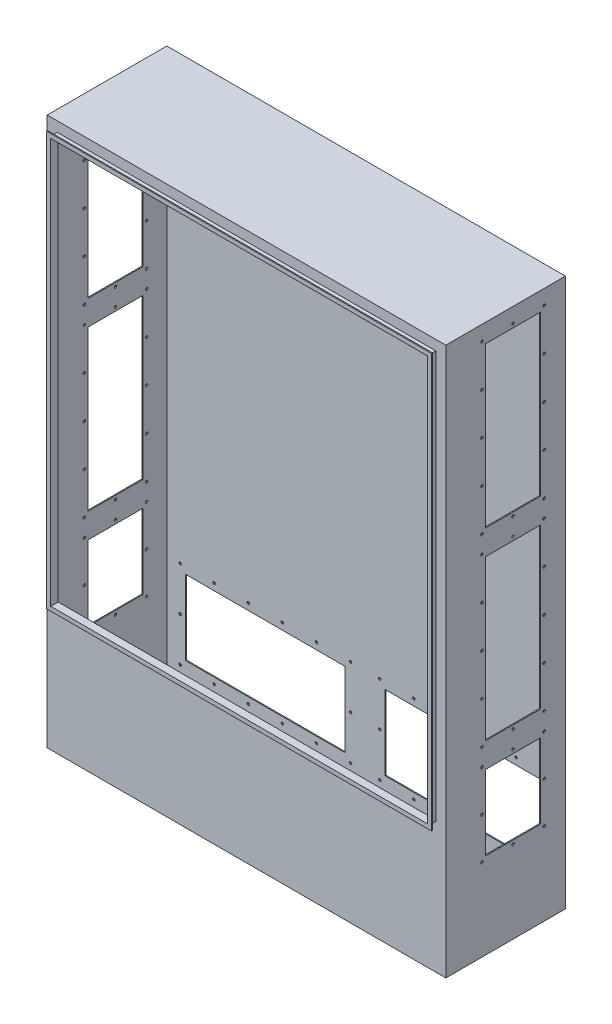
from build123d import *

# Parameters (mm, degrees)
SKETCH1_W               = 1016
SKETCH1_H               = 1397
MAIN_PANEL_DEPTH        = 2.54
SKETCH2_W               = 1016
SKETCH2_H               = 1397
SKETCH2_W_2             = 1010.92
SKETCH2_H_2             = 1391.92
WALLS_DEPTH             = 302.26
SIDE_CUTS_DEPTH         = 1271.063498413
SIDE_CUTS_DEPTH_BACK    = 1271.063498413
SKETCH3_W               = 139.7
SKETCH3_H               = 406.4
SKETCH3_H_2             = 190.5
CAM_HOLES_REACH         = 917.898
SKETCH4_W               = 406.4
SKETCH4_H               = 190.5
SKETCH4_R               = 3.175
BOTTOM_TRAP_DOOR_REACH  = 1517.086
SKETCH5_W               = 609.6
SKETCH5_H               = 101.6
SKETCH6_W               = 1016
SKETCH6_H               = 1397
SKETCH6_W_2             = 965.2
SKETCH6_H_2             = 1038.225
FRONT_FACE_DEPTH        = 2.54
SKETCH7_W               = 965.2
SKETCH7_H               = 1038.225
SKETCH7_W_2             = 960.12
SKETCH7_H_2             = 1033.145
BOSS_EXTRUDE1_DEPTH     = 19.05
SKETCH8_W               = 981.2
SKETCH8_H               = 1054.225
SKETCH8_W_2             = 965.2
SKETCH8_H_2             = 1038.225
BOSS_EXTRUDE2_DEPTH     = 2.54
CUT_EXTRUDE1_DEPTH      = 1364.402820153
CUT_EXTRUDE1_DEPTH_BACK = 1364.402820153
F_3DSKETCH1_R           = 3.175


with BuildPart() as part:
    # Sketch1 → Main Panel (new body)
    with BuildSketch(Plane.XY):
        Rectangle(SKETCH1_W, SKETCH1_H)
    extrude(amount=MAIN_PANEL_DEPTH)

    # Sketch2 → Walls (add)
    with BuildSketch(Plane.XY.offset(2.54)):
        Rectangle(SKETCH2_W, SKETCH2_H)
        Rectangle(SKETCH2_W_2, SKETCH2_H_2, mode=Mode.SUBTRACT)
    extrude(amount=WALLS_DEPTH)

    # Sketch3 → Side Cuts (cut, two sides: drawn at the far end of the back side and taken through both)
    with BuildSketch(Plane(origin=(508, 0, 0), x_dir=(0, 0, -1), z_dir=(1, 0, 0)).offset(-SIDE_CUTS_DEPTH_BACK)):
        with Locations((-133.35, 447.675)):
            Rectangle(SKETCH3_W, SKETCH3_H)
        with Locations((-133.35, -22.225)):
            Rectangle(SKETCH3_W, SKETCH3_H)
        with Locations((-133.35, -384.175)):
            Rectangle(SKETCH3_W, SKETCH3_H_2)
    extrude(amount=SIDE_CUTS_DEPTH + SIDE_CUTS_DEPTH_BACK, mode=Mode.SUBTRACT)

    # Sketch4 → Cam Holes (cut, up to next)
    with BuildSketch(Plane(origin=(0, 0, 0), x_dir=(-1, 0, 0), z_dir=(0, 0, -1)), mode=Mode.PRIVATE) as cam_holes_sk1:
        with Locations((-254.4, -536.575)):
            Rectangle(SKETCH4_W, SKETCH4_H)
    cam_holes_tool1 = extrude(cam_holes_sk1.sketch, amount=-CAM_HOLES_REACH, mode=Mode.PRIVATE) & part.part
    # Sketch4 → Cam Holes (cut, up to next)
    with BuildSketch(Plane(origin=(0, 0, 0), x_dir=(-1, 0, 0), z_dir=(0, 0, -1)), mode=Mode.PRIVATE) as cam_holes_sk2:
        with Locations((-37.23, -536.078621574)):
            Circle(SKETCH4_R)
    cam_holes_tool2 = extrude(cam_holes_sk2.sketch, amount=-CAM_HOLES_REACH, mode=Mode.PRIVATE) & part.part
    # Sketch4 → Cam Holes (cut, up to next)
    with BuildSketch(Plane(origin=(0, 0, 0), x_dir=(-1, 0, 0), z_dir=(0, 0, -1)), mode=Mode.PRIVATE) as cam_holes_sk3:
        with Locations((-471.57, -536.078621574)):
            Circle(SKETCH4_R)
    cam_holes_tool3 = extrude(cam_holes_sk3.sketch, amount=-CAM_HOLES_REACH, mode=Mode.PRIVATE) & part.part
    # Sketch4 → Cam Holes (cut, up to next)
    with BuildSketch(Plane(origin=(0, 0, 0), x_dir=(-1, 0, 0), z_dir=(0, 0, -1)), mode=Mode.PRIVATE) as cam_holes_sk4:
        with Locations((-471.57, -647.725)):
            Circle(SKETCH4_R)
    cam_holes_tool4 = extrude(cam_holes_sk4.sketch, amount=-CAM_HOLES_REACH, mode=Mode.PRIVATE) & part.part
    # Sketch4 → Cam Holes (cut, up to next)
    with BuildSketch(Plane(origin=(0, 0, 0), x_dir=(-1, 0, 0), z_dir=(0, 0, -1)), mode=Mode.PRIVATE) as cam_holes_sk5:
        with Locations((-37.23, -647.725)):
            Circle(SKETCH4_R)
    cam_holes_tool5 = extrude(cam_holes_sk5.sketch, amount=-CAM_HOLES_REACH, mode=Mode.PRIVATE) & part.part
    # Sketch4 → Cam Holes (cut, up to next)
    with BuildSketch(Plane(origin=(0, 0, 0), x_dir=(-1, 0, 0), z_dir=(0, 0, -1)), mode=Mode.PRIVATE) as cam_holes_sk6:
        with Locations((-37.23, -424.432243149)):
            Circle(SKETCH4_R)
    cam_holes_tool6 = extrude(cam_holes_sk6.sketch, amount=-CAM_HOLES_REACH, mode=Mode.PRIVATE) & part.part
    # Sketch4 → Cam Holes (cut, up to next)
    with BuildSketch(Plane(origin=(0, 0, 0), x_dir=(-1, 0, 0), z_dir=(0, 0, -1)), mode=Mode.PRIVATE) as cam_holes_sk7:
        with Locations((-471.57, -424.432243149)):
            Circle(SKETCH4_R)
    cam_holes_tool7 = extrude(cam_holes_sk7.sketch, amount=-CAM_HOLES_REACH, mode=Mode.PRIVATE) & part.part
    # Sketch4 → Cam Holes (cut, up to next)
    with BuildSketch(Plane(origin=(0, 0, 0), x_dir=(-1, 0, 0), z_dir=(0, 0, -1)), mode=Mode.PRIVATE) as cam_holes_sk8:
        with Locations((-124.098, -424.432243149)):
            Circle(SKETCH4_R)
    cam_holes_tool8 = extrude(cam_holes_sk8.sketch, amount=-CAM_HOLES_REACH, mode=Mode.PRIVATE) & part.part
    # Sketch4 → Cam Holes (cut, up to next)
    with BuildSketch(Plane(origin=(0, 0, 0), x_dir=(-1, 0, 0), z_dir=(0, 0, -1)), mode=Mode.PRIVATE) as cam_holes_sk9:
        with Locations((-210.966, -424.432243149)):
            Circle(SKETCH4_R)
    cam_holes_tool9 = extrude(cam_holes_sk9.sketch, amount=-CAM_HOLES_REACH, mode=Mode.PRIVATE) & part.part
    # Sketch4 → Cam Holes (cut, up to next)
    with BuildSketch(Plane(origin=(0, 0, 0), x_dir=(-1, 0, 0), z_dir=(0, 0, -1)), mode=Mode.PRIVATE) as cam_holes_sk10:
        with Locations((-297.834, -424.432243149)):
            Circle(SKETCH4_R)
    cam_holes_tool10 = extrude(cam_holes_sk10.sketch, amount=-CAM_HOLES_REACH, mode=Mode.PRIVATE) & part.part
    # Sketch4 → Cam Holes (cut, up to next)
    with BuildSketch(Plane(origin=(0, 0, 0), x_dir=(-1, 0, 0), z_dir=(0, 0, -1)), mode=Mode.PRIVATE) as cam_holes_sk11:
        with Locations((-384.702, -424.432243149)):
            Circle(SKETCH4_R)
    cam_holes_tool11 = extrude(cam_holes_sk11.sketch, amount=-CAM_HOLES_REACH, mode=Mode.PRIVATE) & part.part
    # Sketch4 → Cam Holes (cut, up to next)
    with BuildSketch(Plane(origin=(0, 0, 0), x_dir=(-1, 0, 0), z_dir=(0, 0, -1)), mode=Mode.PRIVATE) as cam_holes_sk12:
        with Locations((-384.702, -647.725)):
            Circle(SKETCH4_R)
    cam_holes_tool12 = extrude(cam_holes_sk12.sketch, amount=-CAM_HOLES_REACH, mode=Mode.PRIVATE) & part.part
    # Sketch4 → Cam Holes (cut, up to next)
    with BuildSketch(Plane(origin=(0, 0, 0), x_dir=(-1, 0, 0), z_dir=(0, 0, -1)), mode=Mode.PRIVATE) as cam_holes_sk13:
        with Locations((-297.834, -647.725)):
            Circle(SKETCH4_R)
    cam_holes_tool13 = extrude(cam_holes_sk13.sketch, amount=-CAM_HOLES_REACH, mode=Mode.PRIVATE) & part.part
    # Sketch4 → Cam Holes (cut, up to next)
    with BuildSketch(Plane(origin=(0, 0, 0), x_dir=(-1, 0, 0), z_dir=(0, 0, -1)), mode=Mode.PRIVATE) as cam_holes_sk14:
        with Locations((-210.966, -647.725)):
            Circle(SKETCH4_R)
    cam_holes_tool14 = extrude(cam_holes_sk14.sketch, amount=-CAM_HOLES_REACH, mode=Mode.PRIVATE) & part.part
    # Sketch4 → Cam Holes (cut, up to next)
    with BuildSketch(Plane(origin=(0, 0, 0), x_dir=(-1, 0, 0), z_dir=(0, 0, -1)), mode=Mode.PRIVATE) as cam_holes_sk15:
        with Locations((-124.098, -647.725)):
            Circle(SKETCH4_R)
    cam_holes_tool15 = extrude(cam_holes_sk15.sketch, amount=-CAM_HOLES_REACH, mode=Mode.PRIVATE) & part.part
    cam_holes_1 = cam_holes_tool1.solids().sort_by_distance((254.4, -536.575, 0))[0]
    add(cam_holes_1, mode=Mode.SUBTRACT)
    cam_holes_2 = cam_holes_tool2.solids().sort_by_distance((37.23, -536.078622, 0))[0]
    add(cam_holes_2, mode=Mode.SUBTRACT)
    cam_holes_3 = cam_holes_tool3.solids().sort_by_distance((471.57, -536.078622, 0))[0]
    add(cam_holes_3, mode=Mode.SUBTRACT)
    cam_holes_4 = cam_holes_tool4.solids().sort_by_distance((471.57, -647.725, 0))[0]
    add(cam_holes_4, mode=Mode.SUBTRACT)
    cam_holes_5 = cam_holes_tool5.solids().sort_by_distance((37.23, -647.725, 0))[0]
    add(cam_holes_5, mode=Mode.SUBTRACT)
    cam_holes_6 = cam_holes_tool6.solids().sort_by_distance((37.23, -424.432243, 0))[0]
    add(cam_holes_6, mode=Mode.SUBTRACT)
    cam_holes_7 = cam_holes_tool7.solids().sort_by_distance((471.57, -424.432243, 0))[0]
    add(cam_holes_7, mode=Mode.SUBTRACT)
    cam_holes_8 = cam_holes_tool8.solids().sort_by_distance((124.098, -424.432243, 0))[0]
    add(cam_holes_8, mode=Mode.SUBTRACT)
    cam_holes_9 = cam_holes_tool9.solids().sort_by_distance((210.966, -424.432243, 0))[0]
    add(cam_holes_9, mode=Mode.SUBTRACT)
    cam_holes_10 = cam_holes_tool10.solids().sort_by_distance((297.834, -424.432243, 0))[0]
    add(cam_holes_10, mode=Mode.SUBTRACT)
    cam_holes_11 = cam_holes_tool11.solids().sort_by_distance((384.702, -424.432243, 0))[0]
    add(cam_holes_11, mode=Mode.SUBTRACT)
    cam_holes_12 = cam_holes_tool12.solids().sort_by_distance((384.702, -647.725, 0))[0]
    add(cam_holes_12, mode=Mode.SUBTRACT)
    cam_holes_13 = cam_holes_tool13.solids().sort_by_distance((297.834, -647.725, 0))[0]
    add(cam_holes_13, mode=Mode.SUBTRACT)
    cam_holes_14 = cam_holes_tool14.solids().sort_by_distance((210.966, -647.725, 0))[0]
    add(cam_holes_14, mode=Mode.SUBTRACT)
    cam_holes_15 = cam_holes_tool15.solids().sort_by_distance((124.098, -647.725, 0))[0]
    add(cam_holes_15, mode=Mode.SUBTRACT)
    cam_holes = cam_holes_1 + cam_holes_2 + cam_holes_3 + cam_holes_4 + cam_holes_5 + cam_holes_6 + cam_holes_7 + cam_holes_8 + cam_holes_9 + cam_holes_10 + cam_holes_11 + cam_holes_12 + cam_holes_13 + cam_holes_14 + cam_holes_15  # Cam Holes as one shape, for the pattern or mirror that repeats it

    # Sketch5 → Bottom Trap Door (cut, up to next)
    with BuildSketch(Plane(origin=(0, -695.96, 0), x_dir=(1, 0, 0), z_dir=(0, 1, 0)), mode=Mode.PRIVATE) as bottom_trap_door_sk1:
        with Locations((0, -168.275)):
            Rectangle(SKETCH5_W, SKETCH5_H)
    bottom_trap_door_tool1 = extrude(bottom_trap_door_sk1.sketch, amount=-BOTTOM_TRAP_DOOR_REACH, mode=Mode.PRIVATE) & part.part
    add(bottom_trap_door_tool1.solids().sort_by_distance((0, -695.96, 168.275))[0], mode=Mode.SUBTRACT)

    # Sketch6 → Front Face (add)
    with BuildSketch(Plane.XY.offset(304.8)):
        Rectangle(SKETCH6_W, SKETCH6_H)
        with Locations((0, 153.9875)):
            Rectangle(SKETCH6_W_2, SKETCH6_H_2, mode=Mode.SUBTRACT)
    extrude(amount=-FRONT_FACE_DEPTH)

    # 3DSketch1 → Cut-Extrude1 (cut, two sides: drawn at the far end of the back side and taken through both)
    with BuildSketch(Plane(origin=(508, 190.5, 133.35), x_dir=(0, -0.9932453201068373, 0.11603333178818209), z_dir=(1, 0, 0)).offset(-CUT_EXTRUDE1_DEPTH_BACK)):
        Circle(F_3DSKETCH1_R)
        with Locations((-159.003955549, 61.339570433)):
            Circle(F_3DSKETCH1_R)
        with Locations((-264.648010909, 48.997975181)):
            Circle(F_3DSKETCH1_R)
        with Locations((-370.292066269, 36.656379929)):
            Circle(F_3DSKETCH1_R)
        with Locations((-475.936121629, 24.314784676)):
            Circle(F_3DSKETCH1_R)
        with Locations((-457.515830208, -133.362909891)):
            Circle(F_3DSKETCH1_R)
        with Locations((-466.725975918, -54.524062607)):
            Circle(F_3DSKETCH1_R)
        with Locations((-9.210145711, 78.838847283)):
            Circle(F_3DSKETCH1_R)
        with Locations((96.433909649, 91.180442536)):
            Circle(F_3DSKETCH1_R)
        with Locations((9.210145711, -78.838847283)):
            Circle(F_3DSKETCH1_R)
        with Locations((-140.583664128, -96.338124134)):
            Circle(F_3DSKETCH1_R)
        with Locations((-34.939608768, -83.996528881)):
            Circle(F_3DSKETCH1_R)
        with Locations((-44.149754479, -5.157681598)):
            Circle(F_3DSKETCH1_R)
        with Locations((-53.359900189, 73.681165685)):
            Circle(F_3DSKETCH1_R)
        with Locations((307.722020369, 115.86363304)):
            Circle(F_3DSKETCH1_R)
        with Locations((202.077965009, 103.522037788)):
            Circle(F_3DSKETCH1_R)
        with Locations((-351.871774848, -121.021314638)):
            Circle(F_3DSKETCH1_R)
        with Locations((-246.227719488, -108.679719386)):
            Circle(F_3DSKETCH1_R)
        with Locations((431.78636715, -29.472466274)):
            Circle(F_3DSKETCH1_R)
        with Locations((326.14231179, -41.814061527)):
            Circle(F_3DSKETCH1_R)
        with Locations((413.366075729, 128.205228293)):
            Circle(F_3DSKETCH1_R)
        with Locations((220.49825643, -54.155656779)):
            Circle(F_3DSKETCH1_R)
        with Locations((422.576221439, 49.366381009)):
            Circle(F_3DSKETCH1_R)
        with Locations((114.854201071, -66.497252031)):
            Circle(F_3DSKETCH1_R)
        with Locations((561.583108622, 145.520302229)):
            Circle(F_3DSKETCH1_R)
        with Locations((580.003400043, -12.157392338)):
            Circle(F_3DSKETCH1_R)
        with Locations((475.936121629, -24.314784676)):
            Circle(F_3DSKETCH1_R)
        with Locations((457.515830208, 133.362909891)):
            Circle(F_3DSKETCH1_R)
        with Locations((674.860532747, 78.838847283)):
            Circle(F_3DSKETCH1_R)
        with Locations((466.725975918, 54.524062607)):
            Circle(F_3DSKETCH1_R)
        with Locations((684.070678457, 0)):
            Circle(F_3DSKETCH1_R)
        with Locations((665.650387036, 157.677694567)):
            Circle(F_3DSKETCH1_R)
    extrude(amount=CUT_EXTRUDE1_DEPTH + CUT_EXTRUDE1_DEPTH_BACK, mode=Mode.SUBTRACT)

    # Mirror1: Cam Holes across plane
    add(cam_holes.mirror(Plane(origin=(0, 0, 0), x_dir=(0, 0, 1), z_dir=(1, 0, 0))), mode=Mode.SUBTRACT)


with BuildPart() as body_2:
    # Sketch7 → Boss-Extrude1 (new body)
    with BuildSketch(Plane.XY.offset(304.8)):
        with Locations((0, 153.9875)):
            Rectangle(SKETCH7_W, SKETCH7_H)
        with Locations((0, 153.9875)):
            Rectangle(SKETCH7_W_2, SKETCH7_H_2, mode=Mode.SUBTRACT)
    extrude(amount=BOSS_EXTRUDE1_DEPTH)

    # Sketch8 → Boss-Extrude2 (add)
    with BuildSketch(Plane.XY.offset(323.85)):
        with Locations((0, 153.9875)):
            Rectangle(SKETCH8_W, SKETCH8_H)
        with Locations((0, 153.9875)):
            Rectangle(SKETCH8_W_2, SKETCH8_H_2, mode=Mode.SUBTRACT)
    extrude(amount=-BOSS_EXTRUDE2_DEPTH)


solid = Compound([part.part, body_2.part])
